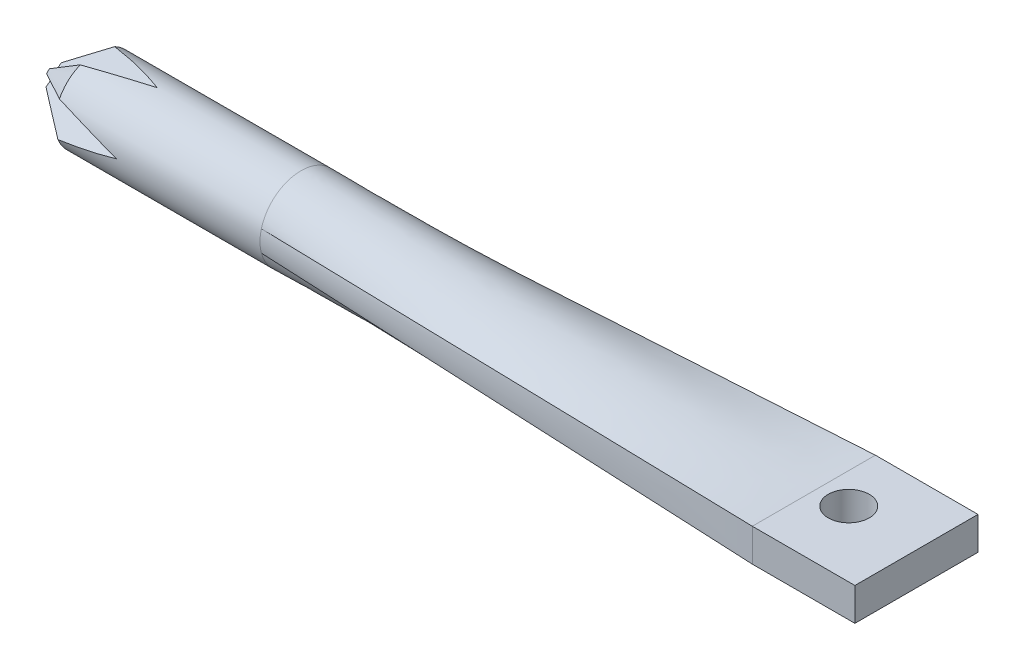
from build123d import *

# Parameters (mm, degrees)
CIRPATTERN11_COUNT  = 4
SKETCH6_W           = 6
SKETCH6_H           = 1.6
BOSS_EXTRUDE1_DEPTH = 5
SKETCH7_R           = 1
CUT_EXTRUDE1_DEPTH  = 43.213338788


with BuildPart() as part:
    # Sketch1 → Revolve1 (revolve)
    with BuildSketch(Plane(origin=(0, 0, 0), x_dir=(1, 0, 0), z_dir=(0, 1, 0)), mode=Mode.PRIVATE) as revolve1_sk:
        Polygon((0, 0), (12, 0), (12, 2), (2, 2), (0, 0.5), align=None)
    revolve(revolve1_sk.sketch.rotate(Axis((0, 0, 0), (1, 0, 0)), 180), axis=Axis((0, 0, 0), (1, 0, 0)))

    # Cut-Sweep1: sweep along a path in Sketch2
    with BuildLine(Plane(origin=(0, 0, 0), x_dir=(1, 0, 0), z_dir=(0, 1, 0))) as cut_sweep1_path:
        Line((5, 2), (0, 0.1))
    # Sketch3 → Cut-Sweep1 (sweep, cut)
    with BuildSketch(Plane.ZY):
        with BuildLine():
            Line((-1.620176628, 1.172615749), (-0.1, 0))
            Line((-0.1, 0), (-1.463329403, -1.363329403))
            ThreePointArc((-1.463329403, -1.363329403), (-1.996185566, -0.123463304), (-1.620176628, 1.172615749))
        make_face()
    cut_sweep1 = sweep(path=cut_sweep1_path.line, mode=Mode.SUBTRACT)

    # CirPattern11: Cut-Sweep1 ×4 about axis
    cirpattern11_axis = Axis((0, 0, 0), (1, 0, 0))
    for i in range(1, CIRPATTERN11_COUNT):
        add(cut_sweep1.rotate(cirpattern11_axis, i * 360 / CIRPATTERN11_COUNT), mode=Mode.SUBTRACT)

    # Loft1: read off the stored shape, not the designer's step
    # Loft1: loft between two sections, ruled curve by curve
    loft1_from = [
        Edge.make_bspline([(12, 0.515325301, -1.932469879), (12, 0.670926961, -1.890976103), (12, 0.836629145, -1.826749948), (12, 1.169302436, -1.633920289), (12, 1.336243508, -1.504744064), (12, 1.635051973, -1.173203502), (12, 1.76618738, -0.970351469), (12, 1.949186886, -0.511537213), (12, 2, -0.256092771), (12, 2, 0.256092771), (12, 1.949186886, 0.511537213), (12, 1.76618738, 0.970351469), (12, 1.635051973, 1.173203502), (12, 1.336243508, 1.504744064), (12, 1.169302436, 1.633920289), (12, 0.836629145, 1.826749948), (12, 0.670926961, 1.890976103), (12, 0.515325301, 1.932469879)], [0, 0, 0, 0, 0.125, 0.125, 0.25, 0.25, 0.375, 0.375, 0.5, 0.5, 0.625, 0.625, 0.75, 0.75, 0.875, 0.875, 1, 1, 1, 1], 3),
        Edge.make_bspline([(12, 0.515325301, 1.932469879), (12, 0.349350197, 1.976729907), (12, 0.174724899, 2), (12, -0.174724899, 2), (12, -0.349350197, 1.976729907), (12, -0.515325301, 1.932469879)], [0, 0, 0, 0, 0.5, 0.5, 1, 1, 1, 1], 3),
        Edge.make_bspline([(12, -0.515325301, -1.932469879), (12, -0.349350197, -1.976729907), (12, -0.174724899, -2), (12, 0.174724899, -2), (12, 0.349350197, -1.976729907), (12, 0.515325301, -1.932469879)], [0, 0, 0, 0, 0.5, 0.5, 1, 1, 1, 1], 3),
        Edge.make_bspline([(12, -0.515325301, 1.932469879), (12, -0.670926961, 1.890976103), (12, -0.836629145, 1.826749948), (12, -1.169302436, 1.633920289), (12, -1.336243508, 1.504744064), (12, -1.635051973, 1.173203502), (12, -1.76618738, 0.970351469), (12, -1.949186886, 0.511537213), (12, -2, 0.256092771), (12, -2, -0.256092771), (12, -1.949186886, -0.511537213), (12, -1.76618738, -0.970351469), (12, -1.635051973, -1.173203502), (12, -1.336243508, -1.504744064), (12, -1.169302436, -1.633920289), (12, -0.836629145, -1.826749948), (12, -0.670926961, -1.890976103), (12, -0.515325301, -1.932469879)], [0, 0, 0, 0, 0.125, 0.125, 0.25, 0.25, 0.375, 0.375, 0.5, 0.5, 0.625, 0.625, 0.75, 0.75, 0.875, 0.875, 1, 1, 1, 1], 3),
    ]
    loft1_to = [
        Edge.make_bspline([(37, 0.991712047, -2.997397622), (37, 0.991712047, -2.747397622), (37, 0.991712047, -2.497397622), (37, 0.991712047, -1.997397622), (37, 0.991712047, -1.747397622), (37, 0.991712047, -1.247397622), (37, 0.991712047, -0.997397622), (37, 0.991712047, -0.497397622), (37, 0.991712047, -0.247397622), (37, 0.991712047, 0.252602378), (37, 0.991712047, 0.502602378), (37, 0.991712047, 1.002602378), (37, 0.991712047, 1.252602378), (37, 0.991712047, 1.752602378), (37, 0.991712047, 2.002602378), (37, 0.991712047, 2.502602378), (37, 0.991712047, 2.752602378), (37, 0.991712047, 3.002602378)], [0, 0, 0, 0, 0.125, 0.125, 0.25, 0.25, 0.375, 0.375, 0.5, 0.5, 0.625, 0.625, 0.75, 0.75, 0.875, 0.875, 1, 1, 1, 1], 3),
        Edge.make_bspline([(37, 0.991712047, 3.002602378), (37, 0.725045381, 3.002602378), (37, 0.458378714, 3.002602378), (37, -0.074954619, 3.002602378), (37, -0.341621286, 3.002602378), (37, -0.608287953, 3.002602378)], [0, 0, 0, 0, 0.5, 0.5, 1, 1, 1, 1], 3),
        Edge.make_bspline([(37, -0.608287953, -2.997397622), (37, -0.341621286, -2.997397622), (37, -0.074954619, -2.997397622), (37, 0.458378714, -2.997397622), (37, 0.725045381, -2.997397622), (37, 0.991712047, -2.997397622)], [0, 0, 0, 0, 0.5, 0.5, 1, 1, 1, 1], 3),
        Edge.make_bspline([(37, -0.608287953, 3.002602378), (37, -0.608287953, 2.752602378), (37, -0.608287953, 2.502602378), (37, -0.608287953, 2.002602378), (37, -0.608287953, 1.752602378), (37, -0.608287953, 1.252602378), (37, -0.608287953, 1.002602378), (37, -0.608287953, 0.502602378), (37, -0.608287953, 0.252602378), (37, -0.608287953, -0.247397622), (37, -0.608287953, -0.497397622), (37, -0.608287953, -0.997397622), (37, -0.608287953, -1.247397622), (37, -0.608287953, -1.747397622), (37, -0.608287953, -1.997397622), (37, -0.608287953, -2.497397622), (37, -0.608287953, -2.747397622), (37, -0.608287953, -2.997397622)], [0, 0, 0, 0, 0.125, 0.125, 0.25, 0.25, 0.375, 0.375, 0.5, 0.5, 0.625, 0.625, 0.75, 0.75, 0.875, 0.875, 1, 1, 1, 1], 3),
    ]
    loft1 = Solid(Shell([*[Face.make_surface_from_curves(loft1_from[k], loft1_to[k]) for k in range(4)], Face(Wire(loft1_from)), Face(Wire(loft1_to))]))
    add(loft1)

    # Sketch6 → Boss-Extrude1 (add)
    with BuildSketch(Plane(origin=(37, 0, 0), x_dir=(0, 0, -1), z_dir=(1, 0, 0))):
        with Locations((-0.002602378, 0.191712047)):
            Rectangle(SKETCH6_W, SKETCH6_H)
    extrude(amount=BOSS_EXTRUDE1_DEPTH)

    # Sketch7 → Cut-Extrude1 (cut, through all)
    with BuildSketch(Plane(origin=(0, 0.991712047, 0), x_dir=(1, 0, 0), z_dir=(0, 1, 0))):
        with Locations(Location((38.5, 0.197397622, 0), (0, 0, 270))):
            Circle(SKETCH7_R)
    extrude(amount=-CUT_EXTRUDE1_DEPTH, mode=Mode.SUBTRACT)


solid = part.part
